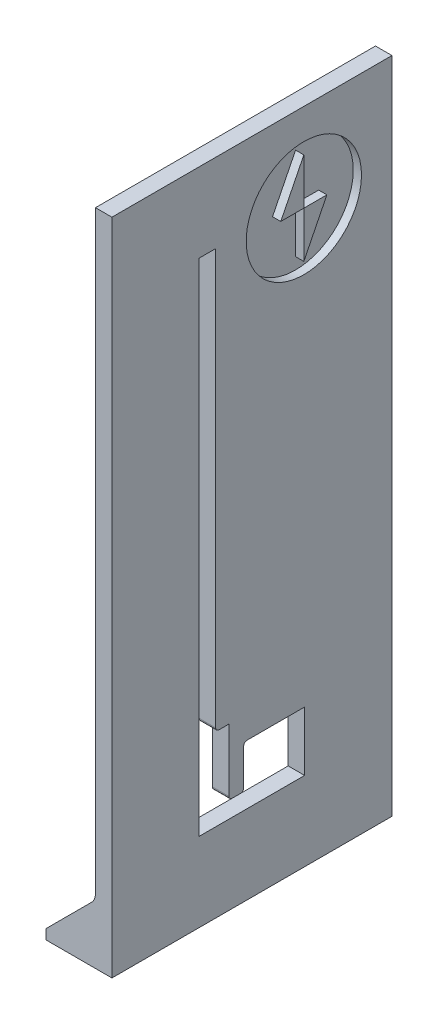
from build123d import *

# Parameters (mm, degrees)
SKETCH1_W           = 85
SKETCH1_H           = 200
BOSS_EXTRUDE1_DEPTH = 5
FILLET1_R           = 1
SKETCH2_R           = 17.5
CUT_EXTRUDE1_DEPTH  = 2.5
FILLET2_R           = 0.125
SKETCH3_W           = 15
SKETCH3_H           = 85
BOSS_EXTRUDE2_DEPTH = 3
RIB1_START          = -5
RIB1_DEPTH          = 5
SKETCH5_R           = 1.5
CUT_EXTRUDE2_DEPTH  = 3
FILLET3_R           = 4
FILLET4_R           = 3


# Read off the part's stored shape, not the designer's step: Rib1
with BuildPart() as part:
    # Sketch1 → Boss-Extrude1 (new body)
    with BuildSketch(Plane(origin=(0, 0, 0), x_dir=(0, 0, -1), z_dir=(1, 0, 0))):
        with Locations((0, 100)):
            Rectangle(SKETCH1_W, SKETCH1_H)
        Polygon((-16, 25), (-16, 176), (-11, 176), (-11, 49), (-7, 49), (-7, 29), (-2.5, 29), (-2.5, 42), (16, 42), (16, 25), (16, 24), (15, 24), (-15, 24), (-16, 24), align=None, mode=Mode.SUBTRACT)
    extrude(amount=BOSS_EXTRUDE1_DEPTH)

    # Fillet1
    fillet1_edges = [part.edges().sort_by_distance(p)[0] for p in [
        (2.5, 42, 2.5),
        (2.5, 29, 2.5),
        (2.5, 29, 7),
        (2.5, 49, 11),
    ]]
    fillet(fillet1_edges, radius=FILLET1_R)

    # Sketch2 → Cut-Extrude1 (cut)
    with BuildSketch(Plane(origin=(5, 0, 0), x_dir=(0, 0, -1), z_dir=(1, 0, 0))):
        with Locations((15.75, 173.25)):
            Circle(SKETCH2_R)
        Polygon((15.75, 173.125), (15.625, 173.25), (8.75, 173.25), (15.75, 187.25), (15.75, 173.375), (15.875, 173.25), (22.75, 173.25), (15.75, 159.25), align=None, mode=Mode.SUBTRACT)
    extrude(amount=-CUT_EXTRUDE1_DEPTH, mode=Mode.SUBTRACT)

    # Fillet2
    fillet2_edges = [part.edges().sort_by_distance(p)[0] for p in [
        (3.75, 173.25, -15.625),
        (3.75, 173.125, -15.75),
        (3.75, 173.25, -15.875),
        (3.75, 173.375, -15.75),
    ]]
    fillet(fillet2_edges, radius=FILLET2_R)

    # Sketch3 → Boss-Extrude2 (add)
    with BuildSketch(Plane.XZ):
        with Locations((-7.5, 0)):
            Rectangle(SKETCH3_W, SKETCH3_H)
    extrude(amount=-BOSS_EXTRUDE2_DEPTH)

    # Rib1 outline → Rib1 (add)
    with BuildSketch(Plane.XY.offset(42.5).offset(RIB1_START)):
        Polygon((0, 18), (-15, 3), (0, 3), align=None)
    rib1 = extrude(amount=RIB1_DEPTH)

    # Mirror1: Rib1 across plane
    add(rib1.mirror(Plane.XY))

    # Sketch5 → Cut-Extrude2 (cut)
    with BuildSketch(Plane(origin=(0, 3, 0), x_dir=(1, 0, 0), z_dir=(0, 1, 0))):
        with Locations(Location((-7.5, 24.5, 0), (0, 0, 270))):
            Circle(SKETCH5_R)
        with Locations(Location((-7.5, 0, 0), (0, 0, 270))):
            Circle(SKETCH5_R)
        with Locations(Location((-7.5, -24.5, 0), (0, 0, 270))):
            Circle(SKETCH5_R)
    extrude(amount=-CUT_EXTRUDE2_DEPTH, mode=Mode.SUBTRACT)

    # Fillet3
    fillet3_edges = [part.edges().sort_by_distance(p)[0] for p in [
        (0, 18, 40),
        (0, 18, -40),
    ]]
    fillet(fillet3_edges, radius=FILLET3_R)

    # Fillet4
    fillet4_edges = [part.edges().sort_by_distance(p)[0] for p in [
        (0, 3, 0),
    ]]
    fillet(fillet4_edges, radius=FILLET4_R)


solid = part.part
